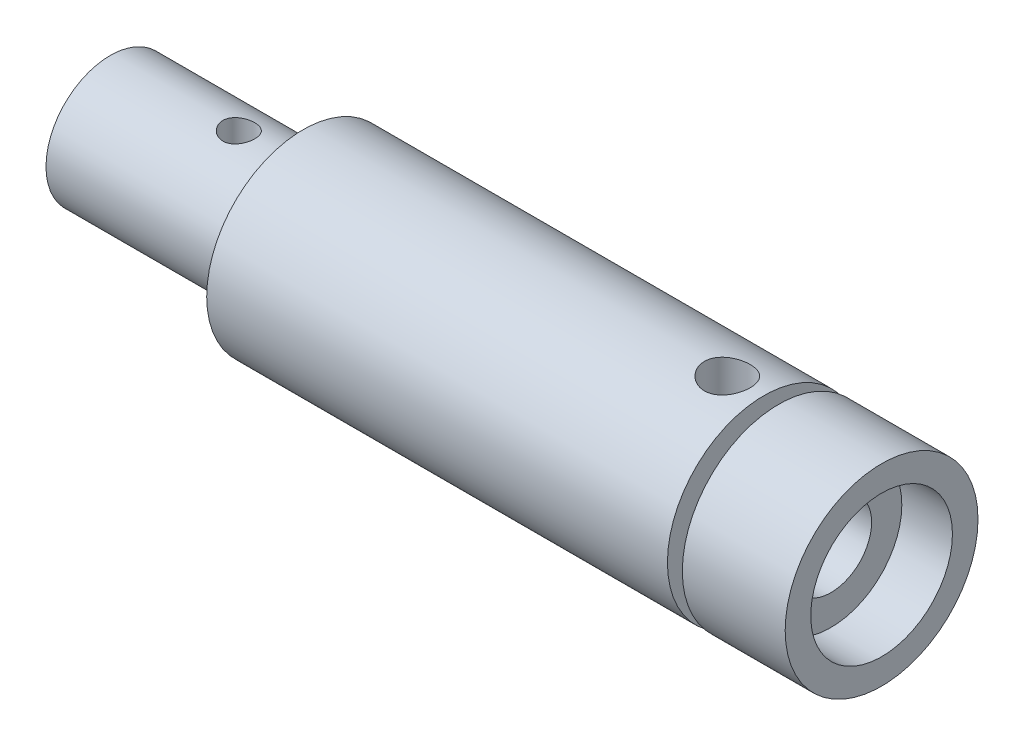
from build123d import *

# Parameters (mm, degrees)
SKETCH1_R               = 4.7625
BOSS_EXTRUDE1_DEPTH     = 38.1
SKETCH2_R               = 2.0066
CUT_EXTRUDE1_DEPTH      = 10.414
SKETCH3_R               = 1.1303
CUT_EXTRUDE2_DEPTH      = 8.6868
SKETCH4_R               = 5.084796601
SKETCH4_R_2             = 3.175
CUT_EXTRUDE3_DEPTH      = 9.525
CUT_EXTRUDE4_DEPTH      = 39.690733028
CUT_EXTRUDE4_DEPTH_BACK = 39.690733028
SKETCH5_R               = 0.7874
SKETCH6_R               = 3.5000057
CUT_EXTRUDE5_DEPTH      = 2.50000008
CUT_EXTRUDE7_START      = -0.7366
SKETCH7_R               = 4.7625
SKETCH7_R_2             = 2.667
CUT_EXTRUDE7_DEPTH      = 0.7366


with BuildPart() as part:
    # Sketch1 → Boss-Extrude1 (new body)
    with BuildSketch(Plane(origin=(0, 0, 0), x_dir=(0, 0, -1), z_dir=(1, 0, 0))):
        Circle(SKETCH1_R)
    extrude(amount=BOSS_EXTRUDE1_DEPTH)

    # Sketch2 → Cut-Extrude1 (cut)
    with BuildSketch(Plane(origin=(38.1, 0, 0), x_dir=(0, 0, -1), z_dir=(1, 0, 0))):
        Circle(SKETCH2_R)
    extrude(amount=-CUT_EXTRUDE1_DEPTH, mode=Mode.SUBTRACT)

    # Sketch3 → Cut-Extrude2 (cut)
    with BuildSketch(Plane(origin=(0, 0, 0), x_dir=(1, 0, 0), z_dir=(0, 1, 0))):
        with Locations((30.48, 0)):
            Circle(SKETCH3_R)
    extrude(amount=CUT_EXTRUDE2_DEPTH, mode=Mode.SUBTRACT)

    # Sketch4 → Cut-Extrude3 (cut)
    with BuildSketch(Plane.ZY):
        Circle(SKETCH4_R)
        Circle(SKETCH4_R_2, mode=Mode.SUBTRACT)
    extrude(amount=-CUT_EXTRUDE3_DEPTH, mode=Mode.SUBTRACT)

    # Sketch5 → Cut-Extrude4 (cut, two sides: drawn at the far end of the back side and taken through both)
    with BuildSketch(Plane(origin=(0, 0, 0), x_dir=(1, 0, 0), z_dir=(0, 1, 0)).offset(-CUT_EXTRUDE4_DEPTH_BACK)):
        with Locations((6.35, 0)):
            Circle(SKETCH5_R)
    extrude(amount=CUT_EXTRUDE4_DEPTH + CUT_EXTRUDE4_DEPTH_BACK, mode=Mode.SUBTRACT)

    # Sketch6 → Cut-Extrude5 (cut)
    with BuildSketch(Plane(origin=(38.1, 0, 0), x_dir=(0, 0, -1), z_dir=(1, 0, 0))):
        Circle(SKETCH6_R)
    extrude(amount=-CUT_EXTRUDE5_DEPTH, mode=Mode.SUBTRACT)

    # Sketch7 → Cut-Extrude7 (cut)
    with BuildSketch(Plane(origin=(33.02, 0, 0), x_dir=(0, 0, -1), z_dir=(1, 0, 0)).offset(CUT_EXTRUDE7_START)):
        Circle(SKETCH7_R)
        Circle(SKETCH7_R_2, mode=Mode.SUBTRACT)
    extrude(amount=CUT_EXTRUDE7_DEPTH, mode=Mode.SUBTRACT)


solid = part.part
